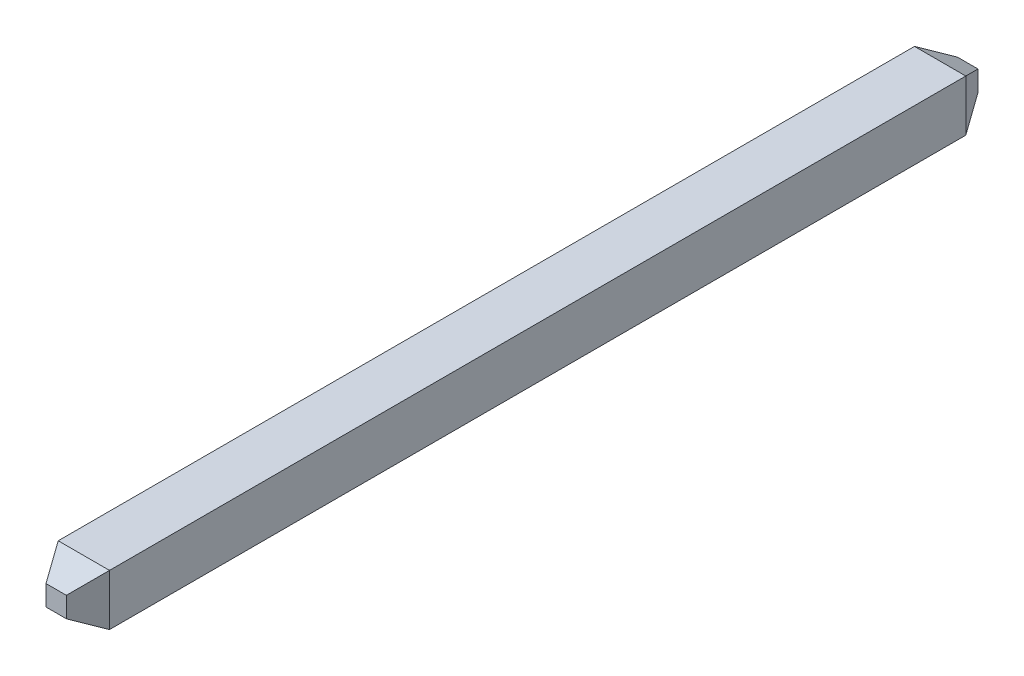
from build123d import *
from OCP.BRepFilletAPI import BRepFilletAPI_MakeChamfer

# Parameters (mm, degrees)
SKETCH1_W           = 0.630214164
SKETCH1_H           = 11.2
BOSS_EXTRUDE1_DEPTH = 0.315
CHAMFER1_SIZE       = 0.19
CHAMFER1_SIZE2      = 0.339999828


with BuildPart() as part:
    # Sketch1 → Boss-Extrude1 (new, symmetric)
    with BuildSketch(Plane(origin=(0, 0, 0), x_dir=(1, 0, 0), z_dir=(0, 1, 0))):
        Rectangle(SKETCH1_W, SKETCH1_H)
    extrude(amount=BOSS_EXTRUDE1_DEPTH, both=True)

    # Chamfer1: one chamfer whose edges measure the first distance from different faces: ONE call of the kernel's chamfer builder (chamfer() names one face for all edges)
    chamfer1_edges_1 = [part.edges().sort_by_distance(p)[0] for p in [
        (-0.315107082, 0, -5.6),
        (0, -0.315, -5.6),
        (0.315107082, 0, -5.6),
        (0, 0.315, -5.6),
    ]]
    chamfer1_side_1 = [part.faces().sort_by_distance(p)[0] for p in [
        (0, 0, -5.6),
    ]]
    chamfer1_edges_2 = [part.edges().sort_by_distance(p)[0] for p in [
        (0.315107082, 0, 5.6),
        (0, -0.315, 5.6),
        (-0.315107082, 0, 5.6),
        (0, 0.315, 5.6),
    ]]
    chamfer1_side_2 = [part.faces().sort_by_distance(p)[0] for p in [
        (0, 0, 5.6),
    ]]
    chamfer1 = BRepFilletAPI_MakeChamfer(part.part.solid().wrapped)
    for e in chamfer1_edges_1:
        chamfer1.Add(CHAMFER1_SIZE, CHAMFER1_SIZE2, e.wrapped, chamfer1_side_1[0].wrapped)  # the first distance lies on this face
    for e in chamfer1_edges_2:
        chamfer1.Add(CHAMFER1_SIZE, CHAMFER1_SIZE2, e.wrapped, chamfer1_side_2[0].wrapped)  # the first distance lies on this face
    add(Compound.cast(chamfer1.Shape()), mode=Mode.REPLACE)


solid = part.part
